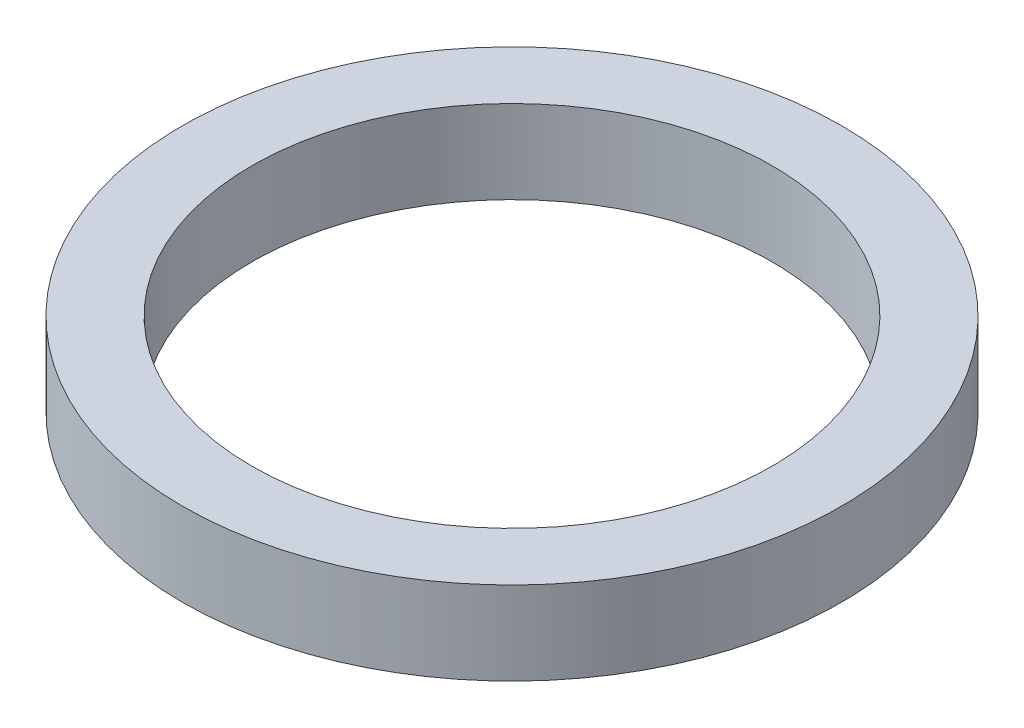
from build123d import *

# Parameters (mm, degrees)
SKETCH1_R           = 47.5
BOSS_EXTRUDE1_DEPTH = 12
SKETCH2_R           = 37.5
CUT_EXTRUDE1_DEPTH  = 69.238552153


with BuildPart() as part:
    # Sketch1 → Boss-Extrude1 (new body)
    with BuildSketch(Plane(origin=(0, 0, 0), x_dir=(1, 0, 0), z_dir=(0, 1, 0))):
        Circle(SKETCH1_R)
    extrude(amount=BOSS_EXTRUDE1_DEPTH)

    # Sketch2 → Cut-Extrude1 (cut, through all)
    with BuildSketch(Plane(origin=(0, 0, 0), x_dir=(1, 0, 0), z_dir=(0, 1, 0))):
        Circle(SKETCH2_R)
    extrude(amount=CUT_EXTRUDE1_DEPTH, mode=Mode.SUBTRACT)


solid = part.part
